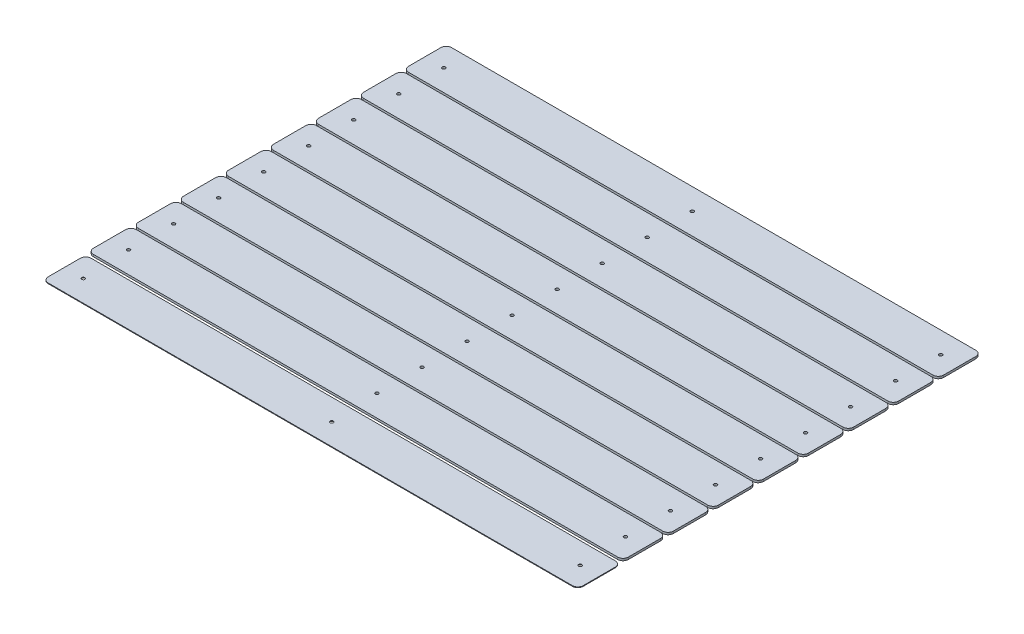
from build123d import *

# Parameters (mm, degrees)
SKETCH1_W             = 633.5522
SKETCH1_H             = 50.8
BOSS_EXTRUDE1_DEPTH   = 0.79375
FILLET1_R             = 6.35
F_6_CLEARANCE_HOLE1_D = 3.7973
SKETCH4_R             = 1.89865
BOSS_EXTRUDE2_DEPTH   = 2.54
BOSS_EXTRUDE2_2_DEPTH = 2.54
BOSS_EXTRUDE2_3_DEPTH = 2.54
BOSS_EXTRUDE2_4_DEPTH = 2.54
BOSS_EXTRUDE2_5_DEPTH = 2.54
BOSS_EXTRUDE2_6_DEPTH = 2.54
BOSS_EXTRUDE2_7_DEPTH = 2.54
BOSS_EXTRUDE2_8_DEPTH = 2.54


with BuildPart() as part:
    # Sketch1 → Boss-Extrude1 (new body)
    with BuildSketch(Plane(origin=(0, 0, 0), x_dir=(1, 0, 0), z_dir=(0, 1, 0))):
        Rectangle(SKETCH1_W, SKETCH1_H)
    extrude(amount=BOSS_EXTRUDE1_DEPTH)

    # Fillet1
    fillet1_edges = [part.edges().sort_by_distance(p)[0] for p in [
        (-316.7761, 0.396875, -25.4),
        (-316.7761, 0.396875, 25.4),
        (316.7761, 0.396875, -25.4),
        (316.7761, 0.396875, 25.4),
    ]]
    fillet(fillet1_edges, radius=FILLET1_R)

    # #6 Clearance Hole1 (through all)
    with Locations(Plane(origin=(0, 0.79375, 0), x_dir=(1, 0, 0), z_dir=(0, 1, 0))):
        with Locations((294.256791216, 0), (0, 0), (-294.256791216, 0)):
            Hole(F_6_CLEARANCE_HOLE1_D / 2)


with BuildPart() as body_2:
    # Sketch4 → Boss-Extrude2 (new body)
    with BuildSketch(Plane(origin=(0, 0.79375, 0), x_dir=(1, 0, 0), z_dir=(0, 1, 0))):
        with BuildLine():
            Line((316.7761, 34.502828987), (316.7761, 72.602828987))
            ThreePointArc((316.7761, 72.602828987), (314.916228061, 77.092957047), (310.4261, 78.952828987))
            Line((310.4261, 78.952828987), (-310.4261, 78.952828987))
            ThreePointArc((-310.4261, 78.952828987), (-314.916228061, 77.092957047), (-316.7761, 72.602828987))
            Line((-316.7761, 72.602828987), (-316.7761, 34.502828987))
            ThreePointArc((-316.7761, 34.502828987), (-314.916228061, 30.012700926), (-310.4261, 28.152828987))
            Line((-310.4261, 28.152828987), (310.4261, 28.152828987))
            ThreePointArc((310.4261, 28.152828987), (314.916228061, 30.012700926), (316.7761, 34.502828987))
        make_face()
        with Locations((294.256791216, 53.552828987)):
            Circle(SKETCH4_R, mode=Mode.SUBTRACT)
        with Locations((0, 53.552828987)):
            Circle(SKETCH4_R, mode=Mode.SUBTRACT)
        with Locations((-294.256791216, 53.552828987)):
            Circle(SKETCH4_R, mode=Mode.SUBTRACT)
    extrude(amount=BOSS_EXTRUDE2_DEPTH)


with BuildPart() as body_3:
    # Sketch4 → Boss-Extrude2 2 (new body)
    with BuildSketch(Plane(origin=(0, 0.79375, 0), x_dir=(1, 0, 0), z_dir=(0, 1, 0))):
        with BuildLine():
            Line((316.7761, 87.842828987), (316.7761, 125.942828987))
            ThreePointArc((316.7761, 125.942828987), (314.916228061, 130.432957047), (310.4261, 132.292828987))
            Line((310.4261, 132.292828987), (-310.4261, 132.292828987))
            ThreePointArc((-310.4261, 132.292828987), (-314.916228061, 130.432957047), (-316.7761, 125.942828987))
            Line((-316.7761, 125.942828987), (-316.7761, 87.842828987))
            ThreePointArc((-316.7761, 87.842828987), (-314.916228061, 83.352700926), (-310.4261, 81.492828987))
            Line((-310.4261, 81.492828987), (310.4261, 81.492828987))
            ThreePointArc((310.4261, 81.492828987), (314.916228061, 83.352700926), (316.7761, 87.842828987))
        make_face()
        with Locations((294.256791216, 106.892828987)):
            Circle(SKETCH4_R, mode=Mode.SUBTRACT)
        with Locations((0, 106.892828987)):
            Circle(SKETCH4_R, mode=Mode.SUBTRACT)
        with Locations((-294.256791216, 106.892828987)):
            Circle(SKETCH4_R, mode=Mode.SUBTRACT)
    extrude(amount=BOSS_EXTRUDE2_2_DEPTH)


with BuildPart() as body_4:
    # Sketch4 → Boss-Extrude2 3 (new body)
    with BuildSketch(Plane(origin=(0, 0.79375, 0), x_dir=(1, 0, 0), z_dir=(0, 1, 0))):
        with BuildLine():
            Line((316.7761, 141.182828987), (316.7761, 179.282828987))
            ThreePointArc((316.7761, 179.282828987), (314.916228061, 183.772957047), (310.4261, 185.632828987))
            Line((310.4261, 185.632828987), (-310.4261, 185.632828987))
            ThreePointArc((-310.4261, 185.632828987), (-314.916228061, 183.772957047), (-316.7761, 179.282828987))
            Line((-316.7761, 179.282828987), (-316.7761, 141.182828987))
            ThreePointArc((-316.7761, 141.182828987), (-314.916228061, 136.692700926), (-310.4261, 134.832828987))
            Line((-310.4261, 134.832828987), (310.4261, 134.832828987))
            ThreePointArc((310.4261, 134.832828987), (314.916228061, 136.692700926), (316.7761, 141.182828987))
        make_face()
        with Locations((294.256791216, 160.232828987)):
            Circle(SKETCH4_R, mode=Mode.SUBTRACT)
        with Locations((0, 160.232828987)):
            Circle(SKETCH4_R, mode=Mode.SUBTRACT)
        with Locations((-294.256791216, 160.232828987)):
            Circle(SKETCH4_R, mode=Mode.SUBTRACT)
    extrude(amount=BOSS_EXTRUDE2_3_DEPTH)


with BuildPart() as body_5:
    # Sketch4 → Boss-Extrude2 4 (new body)
    with BuildSketch(Plane(origin=(0, 0.79375, 0), x_dir=(1, 0, 0), z_dir=(0, 1, 0))):
        with BuildLine():
            Line((316.7761, 194.522828987), (316.7761, 232.622828987))
            ThreePointArc((316.7761, 232.622828987), (314.916228061, 237.112957047), (310.4261, 238.972828987))
            Line((310.4261, 238.972828987), (-310.4261, 238.972828987))
            ThreePointArc((-310.4261, 238.972828987), (-314.916228061, 237.112957047), (-316.7761, 232.622828987))
            Line((-316.7761, 232.622828987), (-316.7761, 194.522828987))
            ThreePointArc((-316.7761, 194.522828987), (-314.916228061, 190.032700926), (-310.4261, 188.172828987))
            Line((-310.4261, 188.172828987), (310.4261, 188.172828987))
            ThreePointArc((310.4261, 188.172828987), (314.916228061, 190.032700926), (316.7761, 194.522828987))
        make_face()
        with Locations((294.256791216, 213.572828987)):
            Circle(SKETCH4_R, mode=Mode.SUBTRACT)
        with Locations((0, 213.572828987)):
            Circle(SKETCH4_R, mode=Mode.SUBTRACT)
        with Locations((-294.256791216, 213.572828987)):
            Circle(SKETCH4_R, mode=Mode.SUBTRACT)
    extrude(amount=BOSS_EXTRUDE2_4_DEPTH)


with BuildPart() as body_6:
    # Sketch4 → Boss-Extrude2 5 (new body)
    with BuildSketch(Plane(origin=(0, 0.79375, 0), x_dir=(1, 0, 0), z_dir=(0, 1, 0))):
        with BuildLine():
            Line((316.7761, 247.862828987), (316.7761, 285.962828987))
            ThreePointArc((316.7761, 285.962828987), (314.916228061, 290.452957047), (310.4261, 292.312828987))
            Line((310.4261, 292.312828987), (-310.4261, 292.312828987))
            ThreePointArc((-310.4261, 292.312828987), (-314.916228061, 290.452957047), (-316.7761, 285.962828987))
            Line((-316.7761, 285.962828987), (-316.7761, 247.862828987))
            ThreePointArc((-316.7761, 247.862828987), (-314.916228061, 243.372700926), (-310.4261, 241.512828987))
            Line((-310.4261, 241.512828987), (310.4261, 241.512828987))
            ThreePointArc((310.4261, 241.512828987), (314.916228061, 243.372700926), (316.7761, 247.862828987))
        make_face()
        with Locations((294.256791216, 266.912828987)):
            Circle(SKETCH4_R, mode=Mode.SUBTRACT)
        with Locations((0, 266.912828987)):
            Circle(SKETCH4_R, mode=Mode.SUBTRACT)
        with Locations((-294.256791216, 266.912828987)):
            Circle(SKETCH4_R, mode=Mode.SUBTRACT)
    extrude(amount=BOSS_EXTRUDE2_5_DEPTH)


with BuildPart() as body_7:
    # Sketch4 → Boss-Extrude2 6 (new body)
    with BuildSketch(Plane(origin=(0, 0.79375, 0), x_dir=(1, 0, 0), z_dir=(0, 1, 0))):
        with BuildLine():
            Line((316.7761, 301.202828987), (316.7761, 339.302828987))
            ThreePointArc((316.7761, 339.302828987), (314.916228061, 343.792957047), (310.4261, 345.652828987))
            Line((310.4261, 345.652828987), (-310.4261, 345.652828987))
            ThreePointArc((-310.4261, 345.652828987), (-314.916228061, 343.792957047), (-316.7761, 339.302828987))
            Line((-316.7761, 339.302828987), (-316.7761, 301.202828987))
            ThreePointArc((-316.7761, 301.202828987), (-314.916228061, 296.712700926), (-310.4261, 294.852828987))
            Line((-310.4261, 294.852828987), (310.4261, 294.852828987))
            ThreePointArc((310.4261, 294.852828987), (314.916228061, 296.712700926), (316.7761, 301.202828987))
        make_face()
        with Locations((294.256791216, 320.252828987)):
            Circle(SKETCH4_R, mode=Mode.SUBTRACT)
        with Locations((0, 320.252828987)):
            Circle(SKETCH4_R, mode=Mode.SUBTRACT)
        with Locations((-294.256791216, 320.252828987)):
            Circle(SKETCH4_R, mode=Mode.SUBTRACT)
    extrude(amount=BOSS_EXTRUDE2_6_DEPTH)


with BuildPart() as body_8:
    # Sketch4 → Boss-Extrude2 7 (new body)
    with BuildSketch(Plane(origin=(0, 0.79375, 0), x_dir=(1, 0, 0), z_dir=(0, 1, 0))):
        with BuildLine():
            Line((316.7761, 354.542828987), (316.7761, 392.642828987))
            ThreePointArc((316.7761, 392.642828987), (314.916228061, 397.132957047), (310.4261, 398.992828987))
            Line((310.4261, 398.992828987), (-310.4261, 398.992828987))
            ThreePointArc((-310.4261, 398.992828987), (-314.916228061, 397.132957047), (-316.7761, 392.642828987))
            Line((-316.7761, 392.642828987), (-316.7761, 354.542828987))
            ThreePointArc((-316.7761, 354.542828987), (-314.916228061, 350.052700926), (-310.4261, 348.192828987))
            Line((-310.4261, 348.192828987), (310.4261, 348.192828987))
            ThreePointArc((310.4261, 348.192828987), (314.916228061, 350.052700926), (316.7761, 354.542828987))
        make_face()
        with Locations((294.256791216, 373.592828987)):
            Circle(SKETCH4_R, mode=Mode.SUBTRACT)
        with Locations((0, 373.592828987)):
            Circle(SKETCH4_R, mode=Mode.SUBTRACT)
        with Locations((-294.256791216, 373.592828987)):
            Circle(SKETCH4_R, mode=Mode.SUBTRACT)
    extrude(amount=BOSS_EXTRUDE2_7_DEPTH)


with BuildPart() as body_9:
    # Sketch4 → Boss-Extrude2 8 (new body)
    with BuildSketch(Plane(origin=(0, 0.79375, 0), x_dir=(1, 0, 0), z_dir=(0, 1, 0))):
        with BuildLine():
            Line((316.7761, 407.882828987), (316.7761, 445.982828987))
            ThreePointArc((316.7761, 445.982828987), (314.916228061, 450.472957047), (310.4261, 452.332828987))
            Line((310.4261, 452.332828987), (-310.4261, 452.332828987))
            ThreePointArc((-310.4261, 452.332828987), (-314.916228061, 450.472957047), (-316.7761, 445.982828987))
            Line((-316.7761, 445.982828987), (-316.7761, 407.882828987))
            ThreePointArc((-316.7761, 407.882828987), (-314.916228061, 403.392700926), (-310.4261, 401.532828987))
            Line((-310.4261, 401.532828987), (310.4261, 401.532828987))
            ThreePointArc((310.4261, 401.532828987), (314.916228061, 403.392700926), (316.7761, 407.882828987))
        make_face()
        with Locations((294.256791216, 426.932828987)):
            Circle(SKETCH4_R, mode=Mode.SUBTRACT)
        with Locations((0, 426.932828987)):
            Circle(SKETCH4_R, mode=Mode.SUBTRACT)
        with Locations((-294.256791216, 426.932828987)):
            Circle(SKETCH4_R, mode=Mode.SUBTRACT)
    extrude(amount=BOSS_EXTRUDE2_8_DEPTH)


solid = Compound([part.part, body_2.part, body_3.part, body_4.part, body_5.part, body_6.part, body_7.part, body_8.part, body_9.part])
